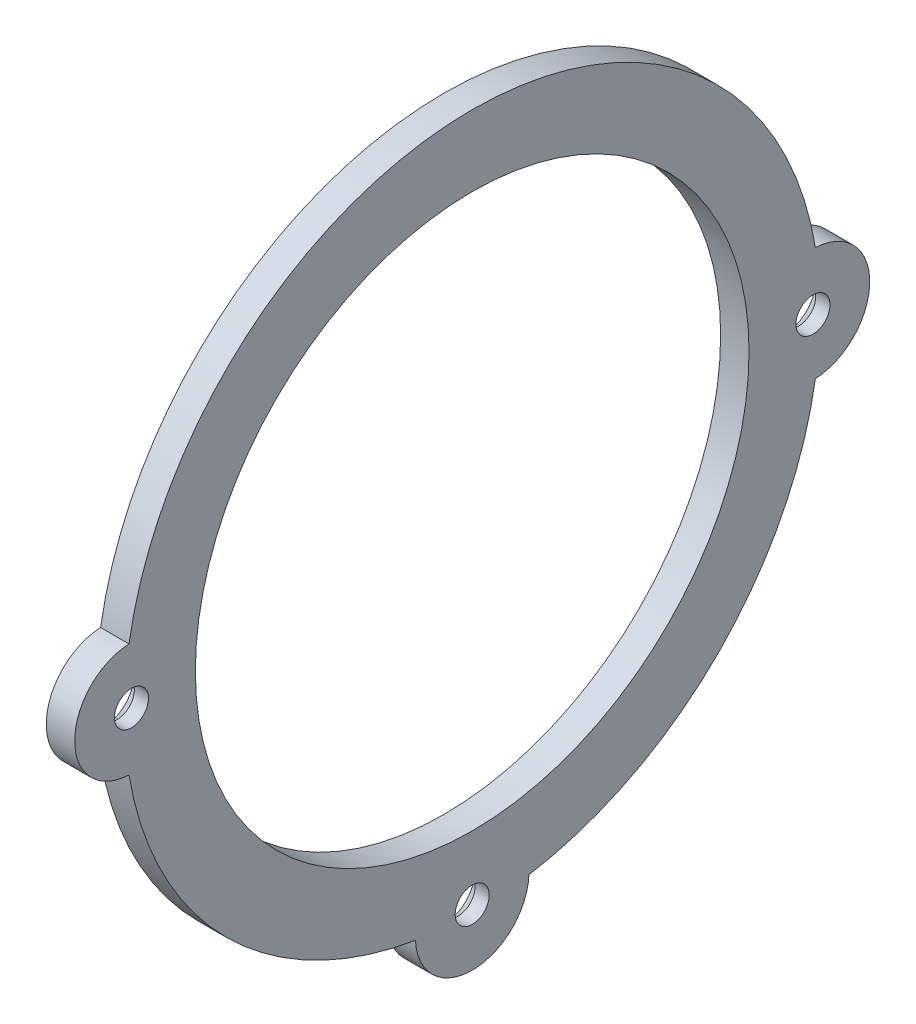
from build123d import *

# Parameters (mm, degrees)
SKETCH_1_R                  = 19.5
EXTRUDE_1_DEPTH             = 2
HOLE_WIZARD_M21_D           = 2.4
HOLE_WIZARD_M21_DEPTH       = 5
HOLE_WIZARD_M21_CSINK_D     = 4.4
HOLE_WIZARD_M21_CSINK_ANGLE = 90
HOLE_WIZARD_M21_TIP         = 0.721032743


with BuildPart() as part:
    # Эскиз1 → Бобышка-Вытянуть1 (new body)
    with BuildSketch(Plane(origin=(0, 0, 0), x_dir=(0, 0, -1), z_dir=(1, 0, 0))):
        with BuildLine():
            ThreePointArc((-24.171875, -3.996305667), (-17.324116139, -17.324116139), (-3.996305667, -24.171875))
            ThreePointArc((-3.996305667, -24.171875), (0, -28), (3.996305667, -24.171875))
            ThreePointArc((3.996305667, -24.171875), (17.324116139, -17.324116139), (24.171875, -3.996305667))
            ThreePointArc((24.171875, -3.996305667), (28, 0), (24.171875, 3.996305667))
            ThreePointArc((24.171875, 3.996305667), (0, 24.5), (-24.171875, 3.996305667))
            ThreePointArc((-24.171875, 3.996305667), (-28, 0), (-24.171875, -3.996305667))
        make_face()
        Circle(SKETCH_1_R, mode=Mode.SUBTRACT)
    extrude(amount=EXTRUDE_1_DEPTH)

    # Зенковка для  винта с плоской головкой M21
    with Locations(Plane(origin=(0, 0, 0), x_dir=(0, 0, -1), z_dir=(-1, 0, 0))):
        with Locations((-24, 0), (0, 24), (24, 0)):
            CounterSinkHole(HOLE_WIZARD_M21_D / 2, HOLE_WIZARD_M21_CSINK_D / 2, depth=HOLE_WIZARD_M21_DEPTH, counter_sink_angle=HOLE_WIZARD_M21_CSINK_ANGLE)
            with Locations((0, 0, -(HOLE_WIZARD_M21_DEPTH + HOLE_WIZARD_M21_TIP / 2))):  # 118° drill point
                Cone(0, HOLE_WIZARD_M21_D / 2, HOLE_WIZARD_M21_TIP, mode=Mode.SUBTRACT)


solid = part.part
